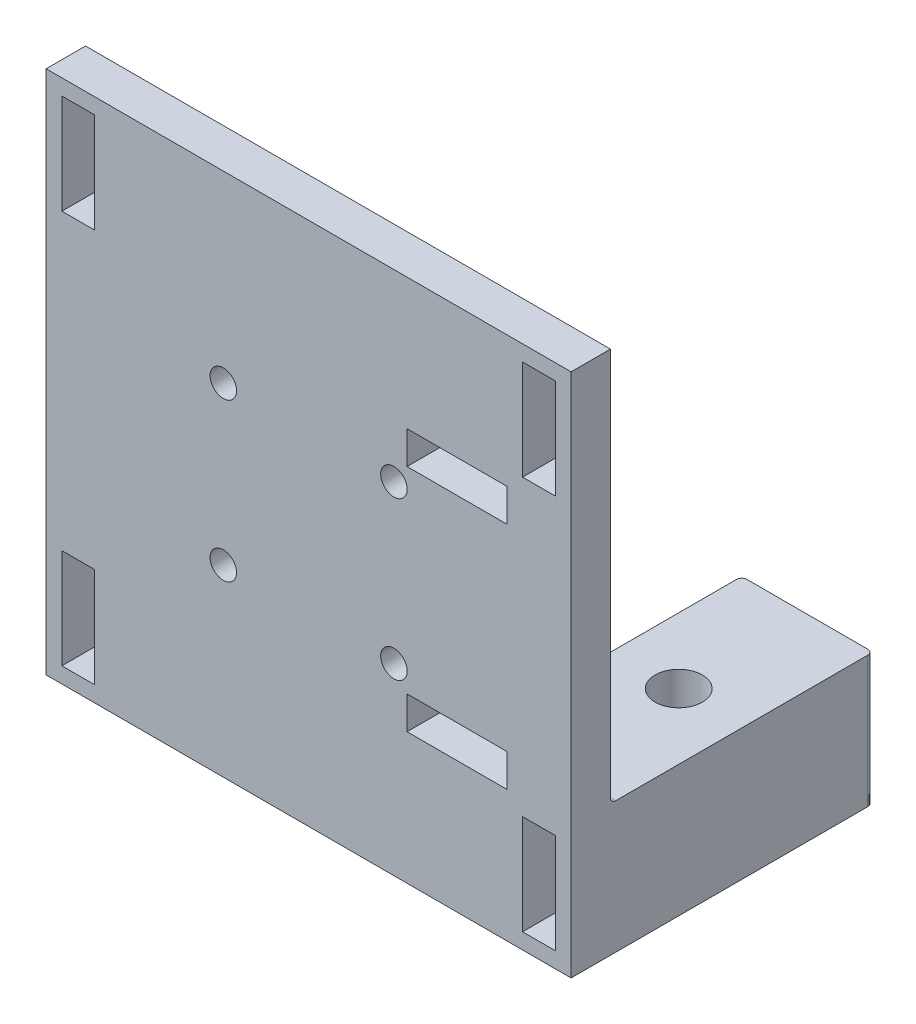
from build123d import *

# Parameters (mm, degrees)
SKETCH1_W           = 40
SKETCH1_H           = 40
SKETCH1_R           = 1.01
BOSS_EXTRUDE1_DEPTH = 3
SKETCH4_W           = 40
SKETCH4_H           = 10
BOSS_EXTRUDE2_DEPTH = 20
FILLET1_R           = 0.4
SKETCH5_R           = 1.8
SKETCH5_W           = 20
SKETCH5_H           = 19.6
CUT_EXTRUDE2_DEPTH  = 42.231056256
SKETCH2_W           = 2.5
SKETCH2_H           = 7.6
SKETCH2_W_2         = 7.6
SKETCH2_H_2         = 2.5
CUT_EXTRUDE1_DEPTH  = 37.455452267
FILLET2_R           = 0.4


with BuildPart() as part:
    # Sketch1 → Boss-Extrude1 (new body)
    with BuildSketch(Plane.XY):
        Rectangle(SKETCH1_W, SKETCH1_H)
        with Locations((6.5, -6)):
            Circle(SKETCH1_R, mode=Mode.SUBTRACT)
        with Locations((-6.5, -6)):
            Circle(SKETCH1_R, mode=Mode.SUBTRACT)
        with Locations((6.5, 6)):
            Circle(SKETCH1_R, mode=Mode.SUBTRACT)
        with Locations((-6.5, 6)):
            Circle(SKETCH1_R, mode=Mode.SUBTRACT)
    extrude(amount=BOSS_EXTRUDE1_DEPTH)

    # Sketch4 → Boss-Extrude2 (add)
    with BuildSketch(Plane(origin=(0, 0, 0), x_dir=(-1, 0, 0), z_dir=(0, 0, -1))):
        with Locations((0, -15)):
            Rectangle(SKETCH4_W, SKETCH4_H)
    extrude(amount=BOSS_EXTRUDE2_DEPTH)

    # Fillet1
    fillet1_edges = [part.edges().sort_by_distance(p)[0] for p in [
        (0, -10, 0),
    ]]
    fillet(fillet1_edges, radius=FILLET1_R)

    # Sketch5 → Cut-Extrude2 (cut, through all)
    with BuildSketch(Plane(origin=(0, -10, 0), x_dir=(1, 0, 0), z_dir=(0, 1, 0))):
        with Locations((15, 10.2)):
            Circle(SKETCH5_R)
        with Locations((-15, 10.2)):
            Circle(SKETCH5_R)
        with Locations((0, 10.2)):
            Rectangle(SKETCH5_W, SKETCH5_H)
    extrude(amount=-CUT_EXTRUDE2_DEPTH, mode=Mode.SUBTRACT)

    # Sketch2 → Cut-Extrude1 (cut, through all)
    with BuildSketch(Plane.XY.offset(3)):
        with Locations((17.55, 15)):
            Rectangle(SKETCH2_W, SKETCH2_H)
        with Locations((-17.55, 15)):
            Rectangle(SKETCH2_W, SKETCH2_H)
        with Locations((11.3, 8.75)):
            Rectangle(SKETCH2_W_2, SKETCH2_H_2)
        with Locations((17.55, -15)):
            Rectangle(SKETCH2_W, SKETCH2_H)
        with Locations((-17.55, -15)):
            Rectangle(SKETCH2_W, SKETCH2_H)
        with Locations((11.3, -8.75)):
            Rectangle(SKETCH2_W_2, SKETCH2_H_2)
    extrude(amount=-CUT_EXTRUDE1_DEPTH, mode=Mode.SUBTRACT)

    # Fillet2
    fillet2_edges = [part.edges().sort_by_distance(p)[0] for p in [
        (-10, -15, -0.4),
        (10, -15, -0.4),
        (-10, -15, -20),
        (-20, -15, -20),
        (20, -15, -20),
        (10, -15, -20),
    ]]
    fillet(fillet2_edges, radius=FILLET2_R)


solid = part.part
